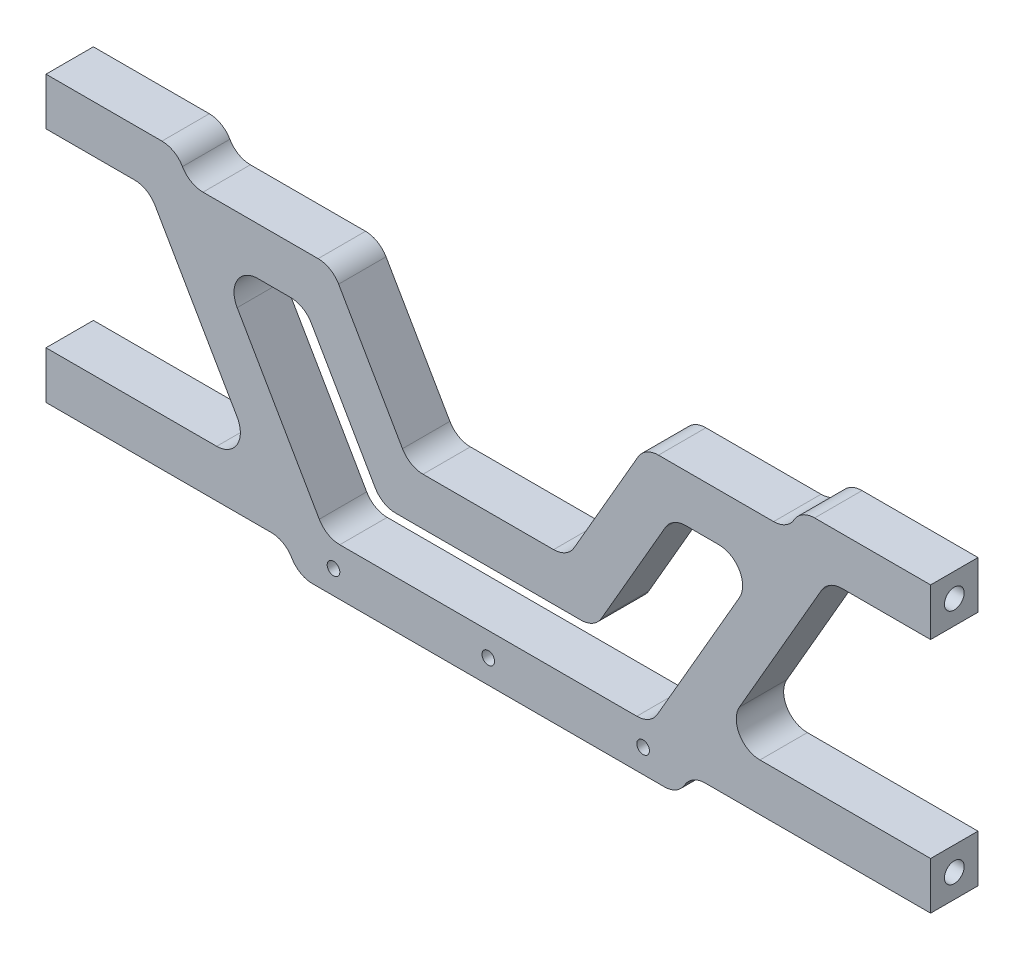
from build123d import *

# Parameters (mm, degrees)
SKETCH1_W                        = 112
SKETCH1_H                        = 39
BOSS_EXTRUDE1_DEPTH              = 6
CUT_EXTRUDE1_REACH               = 70.505
TAP_DRILL_FOR_M3_TAP1_AT_2_COUNT = 2
TAP_DRILL_FOR_M3_TAP1_AT_2_PITCH = 30
FILLET1_R                        = 3
FILLET1_OF_MIRROR1_R             = 3
TAP_DRILL_FOR_M2_TAP1_D          = 1.6


with BuildPart() as part:
    # Sketch1 → Boss-Extrude1 (new body)
    with BuildSketch(Plane.XY):
        with Locations((0, 19.5)):
            Rectangle(SKETCH1_W, SKETCH1_H)
    extrude(amount=BOSS_EXTRUDE1_DEPTH)

    # Sketch2 → Cut-Extrude1 (cut, up to next)
    with BuildSketch(Plane.XY.offset(6), mode=Mode.PRIVATE) as cut_extrude1_sk1:
        Polygon((-56, 33), (-43.052558883, 33), (-29.196152423, 9), (-56, 9), align=None)
    cut_extrude1_tool1 = extrude(cut_extrude1_sk1.sketch, amount=-CUT_EXTRUDE1_REACH, mode=Mode.PRIVATE) & part.part
    # Sketch2 → Cut-Extrude1 (cut, up to next)
    with BuildSketch(Plane.XY.offset(6), mode=Mode.PRIVATE) as cut_extrude1_sk2:
        Polygon((-39.588457268, 39), (-37.856406461, 36), (-19.814954576, 36), (-10, 19), (0, 19), (0, 39), align=None)
    cut_extrude1_tool2 = extrude(cut_extrude1_sk2.sketch, amount=-CUT_EXTRUDE1_REACH, mode=Mode.PRIVATE) & part.part
    # Sketch2 → Cut-Extrude1 (cut, up to next)
    with BuildSketch(Plane.XY.offset(6), mode=Mode.PRIVATE) as cut_extrude1_sk3:
        Polygon((-56, 3), (-25.732050808, 3), (-24, 0), (-56, 0), align=None)
    cut_extrude1_tool3 = extrude(cut_extrude1_sk3.sketch, amount=-CUT_EXTRUDE1_REACH, mode=Mode.PRIVATE) & part.part
    # Sketch2 → Cut-Extrude1 (cut, up to next)
    with BuildSketch(Plane.XY.offset(6), mode=Mode.PRIVATE) as cut_extrude1_sk4:
        Polygon((-13.464101615, 13), (0, 13), (0, 6), (-20.535898385, 6), (-34.392304845, 30), (-23.279056191, 30), align=None)
    cut_extrude1_tool4 = extrude(cut_extrude1_sk4.sketch, amount=-CUT_EXTRUDE1_REACH, mode=Mode.PRIVATE) & part.part
    cut_extrude1_1 = cut_extrude1_tool1.solids().sort_by_distance((-45.659675, 19.60569, 6))[0]
    add(cut_extrude1_1, mode=Mode.SUBTRACT)
    cut_extrude1_2 = cut_extrude1_tool2.solids().sort_by_distance((-11.382019, 31.286174, 6))[0]
    add(cut_extrude1_2, mode=Mode.SUBTRACT)
    cut_extrude1_3 = cut_extrude1_tool3.solids().sort_by_distance((-40.428998, 1.486092, 6))[0]
    add(cut_extrude1_3, mode=Mode.SUBTRACT)
    cut_extrude1_4 = cut_extrude1_tool4.solids().sort_by_distance((-18.182863, 16.08438, 6))[0]
    add(cut_extrude1_4, mode=Mode.SUBTRACT)
    cut_extrude1 = cut_extrude1_1 + cut_extrude1_2 + cut_extrude1_3 + cut_extrude1_4  # Cut-Extrude1 as one shape, for the pattern or mirror that repeats it

    # Sketch3 → Tap Drill for M3 Tap1 (revolve, cut)
    with BuildSketch(Plane(origin=(-56, 36, 3), x_dir=(0, 0, 1), z_dir=(0, 1, 0))):
        Polygon((0, 0), (0, 10.751075774), (1.25, 10), (1.25, 0), align=None)
    tap_drill_for_m3_tap1 = revolve(axis=Axis((-62.35, 36, 3), (1, 0, 0)), mode=Mode.SUBTRACT)

    # Tap Drill for M3 Tap1 at 2: Tap Drill for M3 Tap1 ×2
    with Locations(*[(0, -i * TAP_DRILL_FOR_M3_TAP1_AT_2_PITCH, 0) for i in range(1, TAP_DRILL_FOR_M3_TAP1_AT_2_COUNT)]):
        add(tap_drill_for_m3_tap1, mode=Mode.SUBTRACT)

    # Fillet1
    fillet1_edges = [part.edges().sort_by_distance(p)[0] for p in [
        (-43.052558883, 33, 3),
        (-29.196152423, 9, 3),
        (-39.588457268, 39, 3),
        (-10, 19, 3),
        (-19.814954576, 36, 3),
        (-37.856406461, 36, 3),
        (-23.279056191, 30, 3),
        (-13.464101615, 13, 3),
        (-20.535898385, 6, 3),
        (-34.392304845, 30, 3),
        (-25.732050808, 3, 3),
        (-24, 0, 3),
    ]]
    fillet(fillet1_edges, radius=FILLET1_R - 0.0001)  # a hair under: the kernel refuses the full size

    # Mirror1: Cut-Extrude1, Tap Drill for M3 Tap1 across plane
    add(cut_extrude1.mirror(Plane(origin=(0, 0, 0), x_dir=(0, 0, 1), z_dir=(1, 0, 0))), mode=Mode.SUBTRACT)
    add(tap_drill_for_m3_tap1.mirror(Plane(origin=(0, 0, 0), x_dir=(0, 0, 1), z_dir=(1, 0, 0))), mode=Mode.SUBTRACT)

    # Mirror1 copy 1 sketch → Mirror1 copy 1 (revolve, cut)
    with BuildSketch(Plane(origin=(56, 6, 3), x_dir=(0, 0, 1), z_dir=(0, 1, 0))):
        Polygon((0, 0), (0, -10.751075774), (1.25, -10), (1.25, 0), align=None)
    revolve(axis=Axis((62.35, 6, 3), (1, 0, 0)), mode=Mode.SUBTRACT)

    # Fillet1 of Mirror1
    fillet1_of_mirror1_edges = [part.edges().sort_by_distance(p)[0] for p in [
        (43.052558883, 33, 3),
        (29.196152423, 9, 3),
        (39.588457268, 39, 3),
        (10, 19, 3),
        (19.814954576, 36, 3),
        (37.856406461, 36, 3),
        (23.279056191, 30, 3),
        (13.464101615, 13, 3),
        (20.535898385, 6, 3),
        (34.392304845, 30, 3),
        (25.732050808, 3, 3),
        (24, 0, 3),
    ]]
    fillet(fillet1_of_mirror1_edges, radius=FILLET1_OF_MIRROR1_R - 0.0001)  # a hair under: the kernel refuses the full size

    # Tap Drill for M2 Tap1 (through all)
    with Locations(Plane.XY.offset(6)):
        with Locations((-19.6, 3), (0, 3), (19.6, 3)):
            Hole(TAP_DRILL_FOR_M2_TAP1_D / 2)


solid = part.part
